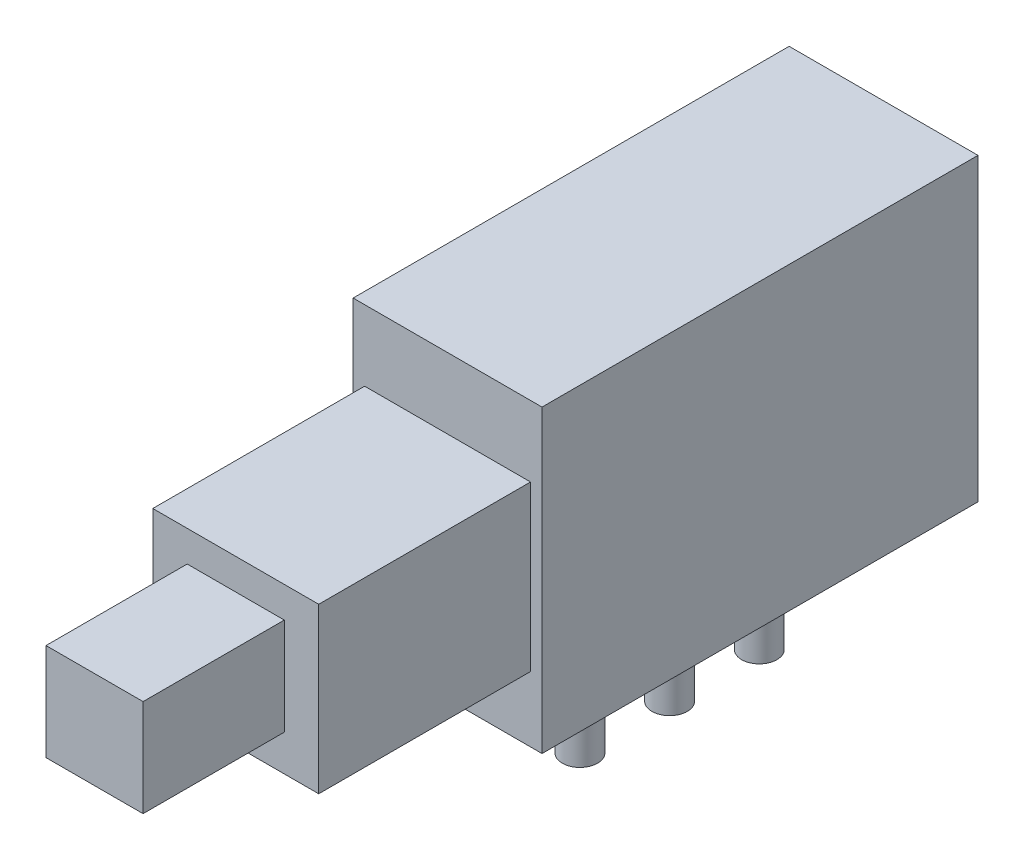
from build123d import *

# Parameters (mm, degrees)
SKETCH1_W           = 5.35
SKETCH1_H           = 8.5
BOSS_EXTRUDE1_DEPTH = 12.35
SKETCH2_W           = 2.75
SKETCH2_H           = 2.75
BOSS_EXTRUDE2_DEPTH = 10
SKETCH4_W           = 4.7
SKETCH4_H           = 4.65
BOSS_EXTRUDE4_DEPTH = 6
SKETCH3_R           = 0.5
BOSS_EXTRUDE3_DEPTH = 3.2


with BuildPart() as part:
    # Sketch1 → Boss-Extrude1 (new body)
    with BuildSketch(Plane.XY):
        Rectangle(SKETCH1_W, SKETCH1_H)
    extrude(amount=BOSS_EXTRUDE1_DEPTH)

    # Sketch2 → Boss-Extrude2 (add)
    with BuildSketch(Plane.XY.offset(12.35)):
        Rectangle(SKETCH2_W, SKETCH2_H)
    extrude(amount=BOSS_EXTRUDE2_DEPTH)

    # Sketch4 → Boss-Extrude4 (add)
    with BuildSketch(Plane.XY.offset(12.35)):
        with Locations((0, -0.075)):
            Rectangle(SKETCH4_W, SKETCH4_H)
    extrude(amount=BOSS_EXTRUDE4_DEPTH)

    # Sketch3 → Boss-Extrude3 (add)
    with BuildSketch(Plane.XZ.offset(4.25)):
        with Locations((0, 8.6)):
            Circle(SKETCH3_R)
        with Locations((0, 6.06)):
            Circle(SKETCH3_R)
        with Locations((0, 3.52)):
            Circle(SKETCH3_R)
    extrude(amount=BOSS_EXTRUDE3_DEPTH)


solid = part.part
